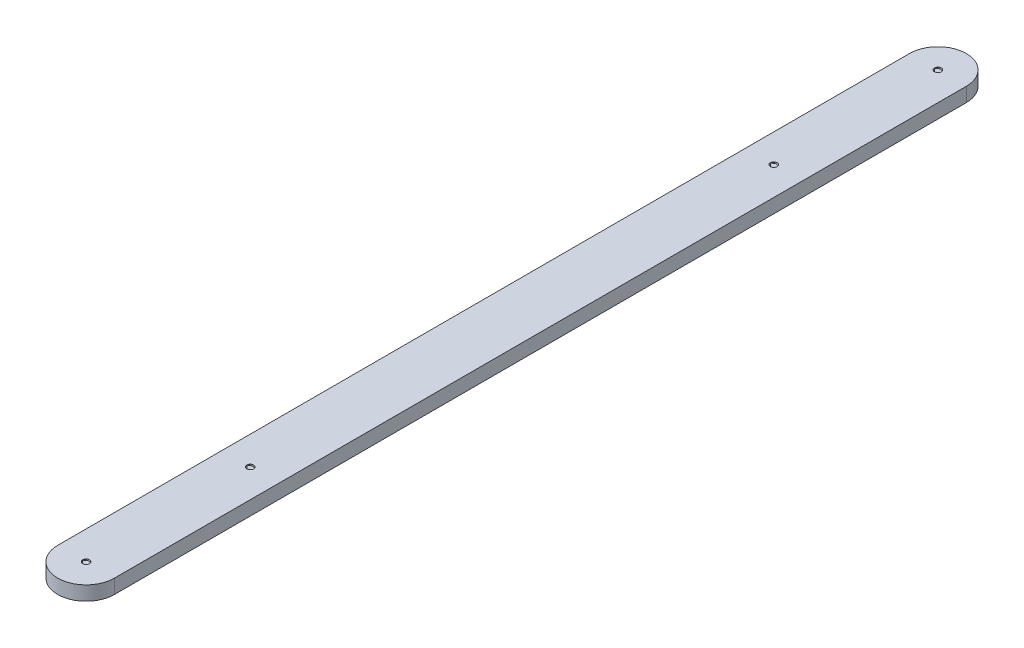
from build123d import *

# Parameters (mm, degrees)
BOSS_EXTRUDE1_DEPTH = 2.5
SKETCH2_R           = 0.6
CUT_EXTRUDE1_DEPTH  = 10
THREAD1_PITCH       = 1.25
THREAD2_PITCH       = 1.25
THREAD3_PITCH       = 1.25
THREAD4_PITCH       = 1.25


with BuildPart() as part:
    # Sketch1 → Boss-Extrude1 (new body)
    with BuildSketch(Plane(origin=(0, 0, 0), x_dir=(1, 0, 0), z_dir=(0, 1, 0))):
        with BuildLine():
            Line((-5, -75), (-5, 75))
            ThreePointArc((-5, 75), (0, 80), (5, 75))
            Line((5, 75), (5, -75))
            ThreePointArc((5, -75), (0, -80), (-5, -75))
        make_face()
    extrude(amount=BOSS_EXTRUDE1_DEPTH)

    # Sketch2 → Cut-Extrude1 (cut)
    with BuildSketch(Plane(origin=(0, 2.5, 0), x_dir=(1, 0, 0), z_dir=(0, 1, 0))):
        with Locations(Location((0, 75, 0), (0, 0, 270))):
            Circle(SKETCH2_R)
        with Locations(Location((0, 46.1, 0), (0, 0, 270))):
            Circle(SKETCH2_R)
        with Locations(Location((0, -46.1, 0), (0, 0, 90))):
            Circle(SKETCH2_R)
        with Locations(Location((0, -75, 0), (0, 0, 90))):
            Circle(SKETCH2_R)
    extrude(amount=-CUT_EXTRUDE1_DEPTH, mode=Mode.SUBTRACT)

    # Thread1: the profile of Thread Profile2 profile screwed along a right-hand helix of 8 turns, 8 arcs to a turn; built about Z, then put on its axis
    thread1_z = Axis((0, 0, 0), (0, 0, 1))
    thread1_corners = [(0.5997, 0, -0.000173205), (1.276582344, 0, 0.390624998), (1.276582344, 0, 0.546874998), (0.5997, 0, 0.937673202)]
    with BuildLine(mode=Mode.PRIVATE) as thread1_profile:
        Line(thread1_corners[0], thread1_corners[1])
        Line(thread1_corners[1], thread1_corners[2])
        Line(thread1_corners[2], thread1_corners[3])
        Line(thread1_corners[3], thread1_corners[0])
    thread1_cap = Face(thread1_profile.wire())
    thread1_turn_angles = [0, 22.5, 45, 67.5, 90, 112.5, 135, 157.5, 180, 202.5, 225, 247.5, 270, 292.5, 315, 337.5, 360]
    thread1_turn_weights = [1, 0.9238795325112867, 1, 0.9238795325112867, 1, 0.9238795325112867, 1, 0.9238795325112867, 1, 0.9238795325112867, 1, 0.9238795325112867, 1, 0.9238795325112867, 1, 0.9238795325112867, 1]
    thread1_turn_rails = [Edge.make_bspline([Vector(p[0], p[1], 0).rotate(thread1_z, thread1_turn_angles[k]) / thread1_turn_weights[k] + Vector(0, 0, p[2] + THREAD1_PITCH * thread1_turn_angles[k] / 360) for k in range(17)], [0, 0, 0, 1, 1, 2, 2, 3, 3, 4, 4, 5, 5, 6, 6, 7, 7, 8, 8, 8], 2, thread1_turn_weights) for p in thread1_corners]
    thread1_turn_sides = [Face.make_surface_from_curves(thread1_turn_rails[p[0]], thread1_turn_rails[p[1]]) for p in [(0, 1), (1, 2), (2, 3), (3, 0)]]
    thread1 = Plane(origin=(0, 2.5, 75), x_dir=(-1, 0, 0), z_dir=(0, -1, 0)) * Solid(Shell([*[p.moved(Location((0, 0, THREAD1_PITCH * i))) for i in range(8) for p in thread1_turn_sides], thread1_cap, thread1_cap.rotate(thread1_z, 2880).moved(Location((0, 0, THREAD1_PITCH * 2880 / 360)))]))
    add(thread1, mode=Mode.SUBTRACT)

    # Thread2: the profile of Thread Profile3 profile screwed along a right-hand helix of 8 turns, 8 arcs to a turn; built about Z, then put on its axis
    thread2_z = Axis((0, 0, 0), (0, 0, 1))
    thread2_corners = [(0.5997, 0, -0.000173205), (1.276582344, 0, 0.390624998), (1.276582344, 0, 0.546874998), (0.5997, 0, 0.937673202)]
    with BuildLine(mode=Mode.PRIVATE) as thread2_profile:
        Line(thread2_corners[0], thread2_corners[1])
        Line(thread2_corners[1], thread2_corners[2])
        Line(thread2_corners[2], thread2_corners[3])
        Line(thread2_corners[3], thread2_corners[0])
    thread2_cap = Face(thread2_profile.wire())
    thread2_turn_angles = [0, 22.5, 45, 67.5, 90, 112.5, 135, 157.5, 180, 202.5, 225, 247.5, 270, 292.5, 315, 337.5, 360]
    thread2_turn_weights = [1, 0.9238795325112867, 1, 0.9238795325112867, 1, 0.9238795325112867, 1, 0.9238795325112867, 1, 0.9238795325112867, 1, 0.9238795325112867, 1, 0.9238795325112867, 1, 0.9238795325112867, 1]
    thread2_turn_rails = [Edge.make_bspline([Vector(p[0], p[1], 0).rotate(thread2_z, thread2_turn_angles[k]) / thread2_turn_weights[k] + Vector(0, 0, p[2] + THREAD2_PITCH * thread2_turn_angles[k] / 360) for k in range(17)], [0, 0, 0, 1, 1, 2, 2, 3, 3, 4, 4, 5, 5, 6, 6, 7, 7, 8, 8, 8], 2, thread2_turn_weights) for p in thread2_corners]
    thread2_turn_sides = [Face.make_surface_from_curves(thread2_turn_rails[p[0]], thread2_turn_rails[p[1]]) for p in [(0, 1), (1, 2), (2, 3), (3, 0)]]
    thread2 = Plane(origin=(0, 2.5, 46.1), x_dir=(-1, 0, 0), z_dir=(0, -1, 0)) * Solid(Shell([*[p.moved(Location((0, 0, THREAD2_PITCH * i))) for i in range(8) for p in thread2_turn_sides], thread2_cap, thread2_cap.rotate(thread2_z, 2880).moved(Location((0, 0, THREAD2_PITCH * 2880 / 360)))]))
    add(thread2, mode=Mode.SUBTRACT)

    # Thread3: the profile of Thread Profile4 profile screwed along a right-hand helix of 8 turns, 8 arcs to a turn; built about Z, then put on its axis
    thread3_z = Axis((0, 0, 0), (0, 0, 1))
    thread3_corners = [(0.5997, 0, -0.000173205), (1.276582344, 0, 0.390624998), (1.276582344, 0, 0.546874998), (0.5997, 0, 0.937673202)]
    with BuildLine(mode=Mode.PRIVATE) as thread3_profile:
        Line(thread3_corners[0], thread3_corners[1])
        Line(thread3_corners[1], thread3_corners[2])
        Line(thread3_corners[2], thread3_corners[3])
        Line(thread3_corners[3], thread3_corners[0])
    thread3_cap = Face(thread3_profile.wire())
    thread3_turn_angles = [0, 22.5, 45, 67.5, 90, 112.5, 135, 157.5, 180, 202.5, 225, 247.5, 270, 292.5, 315, 337.5, 360]
    thread3_turn_weights = [1, 0.9238795325112867, 1, 0.9238795325112867, 1, 0.9238795325112867, 1, 0.9238795325112867, 1, 0.9238795325112867, 1, 0.9238795325112867, 1, 0.9238795325112867, 1, 0.9238795325112867, 1]
    thread3_turn_rails = [Edge.make_bspline([Vector(p[0], p[1], 0).rotate(thread3_z, thread3_turn_angles[k]) / thread3_turn_weights[k] + Vector(0, 0, p[2] + THREAD3_PITCH * thread3_turn_angles[k] / 360) for k in range(17)], [0, 0, 0, 1, 1, 2, 2, 3, 3, 4, 4, 5, 5, 6, 6, 7, 7, 8, 8, 8], 2, thread3_turn_weights) for p in thread3_corners]
    thread3_turn_sides = [Face.make_surface_from_curves(thread3_turn_rails[p[0]], thread3_turn_rails[p[1]]) for p in [(0, 1), (1, 2), (2, 3), (3, 0)]]
    thread3 = Plane(origin=(0, 2.5, -46.1), x_dir=(-1, 0, 0), z_dir=(0, -1, 0)) * Solid(Shell([*[p.moved(Location((0, 0, THREAD3_PITCH * i))) for i in range(8) for p in thread3_turn_sides], thread3_cap, thread3_cap.rotate(thread3_z, 2880).moved(Location((0, 0, THREAD3_PITCH * 2880 / 360)))]))
    add(thread3, mode=Mode.SUBTRACT)

    # Thread4: the profile of Thread Profile5 profile screwed along a right-hand helix of 16 turns, 8 arcs to a turn; built about Z, then put on its axis
    thread4_z = Axis((0, 0, 0), (0, 0, 1))
    thread4_corners = [(0.5997, 0, -0.000173205), (1.276582344, 0, 0.390624998), (1.276582344, 0, 0.546874998), (0.5997, 0, 0.937673202)]
    with BuildLine(mode=Mode.PRIVATE) as thread4_profile:
        Line(thread4_corners[0], thread4_corners[1])
        Line(thread4_corners[1], thread4_corners[2])
        Line(thread4_corners[2], thread4_corners[3])
        Line(thread4_corners[3], thread4_corners[0])
    thread4_cap = Face(thread4_profile.wire())
    thread4_turn_angles = [0, 22.5, 45, 67.5, 90, 112.5, 135, 157.5, 180, 202.5, 225, 247.5, 270, 292.5, 315, 337.5, 360]
    thread4_turn_weights = [1, 0.9238795325112867, 1, 0.9238795325112867, 1, 0.9238795325112867, 1, 0.9238795325112867, 1, 0.9238795325112867, 1, 0.9238795325112867, 1, 0.9238795325112867, 1, 0.9238795325112867, 1]
    thread4_turn_rails = [Edge.make_bspline([Vector(p[0], p[1], 0).rotate(thread4_z, thread4_turn_angles[k]) / thread4_turn_weights[k] + Vector(0, 0, p[2] + THREAD4_PITCH * thread4_turn_angles[k] / 360) for k in range(17)], [0, 0, 0, 1, 1, 2, 2, 3, 3, 4, 4, 5, 5, 6, 6, 7, 7, 8, 8, 8], 2, thread4_turn_weights) for p in thread4_corners]
    thread4_turn_sides = [Face.make_surface_from_curves(thread4_turn_rails[p[0]], thread4_turn_rails[p[1]]) for p in [(0, 1), (1, 2), (2, 3), (3, 0)]]
    thread4 = Plane(origin=(0, 2.5, -75), x_dir=(-1, 0, 0), z_dir=(0, -1, 0)) * Solid(Shell([*[p.moved(Location((0, 0, THREAD4_PITCH * i))) for i in range(16) for p in thread4_turn_sides], thread4_cap, thread4_cap.rotate(thread4_z, 5760).moved(Location((0, 0, THREAD4_PITCH * 5760 / 360)))]))
    add(thread4, mode=Mode.SUBTRACT)


solid = part.part
